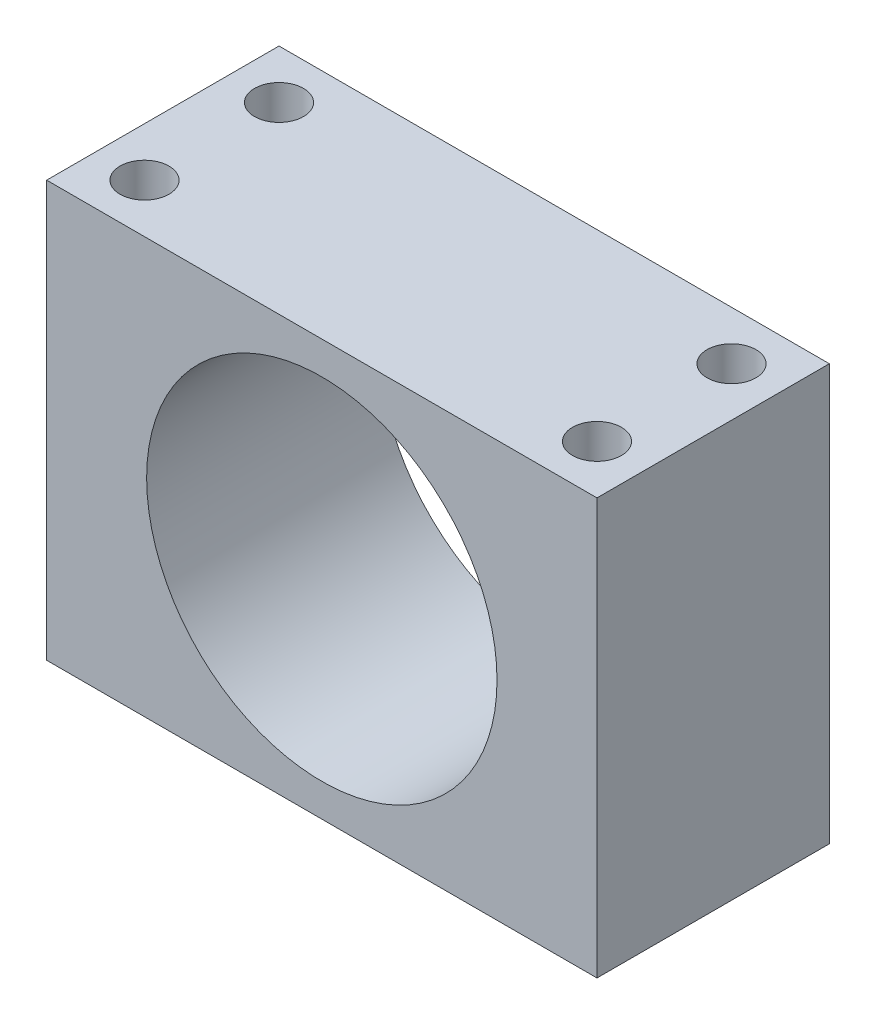
from build123d import *

# Parameters (mm, degrees)
SKETCH1_W           = 90
SKETCH1_H           = 68
SKETCH1_R           = 28.65
BOSS_EXTRUDE1_DEPTH = 19
SKETCH2_R           = 4
CUT_EXTRUDE1_DEPTH  = 84.725742756


with BuildPart() as part:
    # Sketch1 → Boss-Extrude1 (new, symmetric)
    with BuildSketch(Plane.XY):
        Rectangle(SKETCH1_W, SKETCH1_H)
        Circle(SKETCH1_R, mode=Mode.SUBTRACT)
    extrude(amount=BOSS_EXTRUDE1_DEPTH, both=True)

    # Sketch2 → Cut-Extrude1 (cut, through all)
    with BuildSketch(Plane(origin=(0, 34, 0), x_dir=(1, 0, 0), z_dir=(0, 1, 0))):
        with Locations((-37, 11)):
            Circle(SKETCH2_R)
        with Locations((-37, -11)):
            Circle(SKETCH2_R)
        with Locations((37, 11)):
            Circle(SKETCH2_R)
        with Locations((37, -11)):
            Circle(SKETCH2_R)
    extrude(amount=-CUT_EXTRUDE1_DEPTH, mode=Mode.SUBTRACT)


solid = part.part
